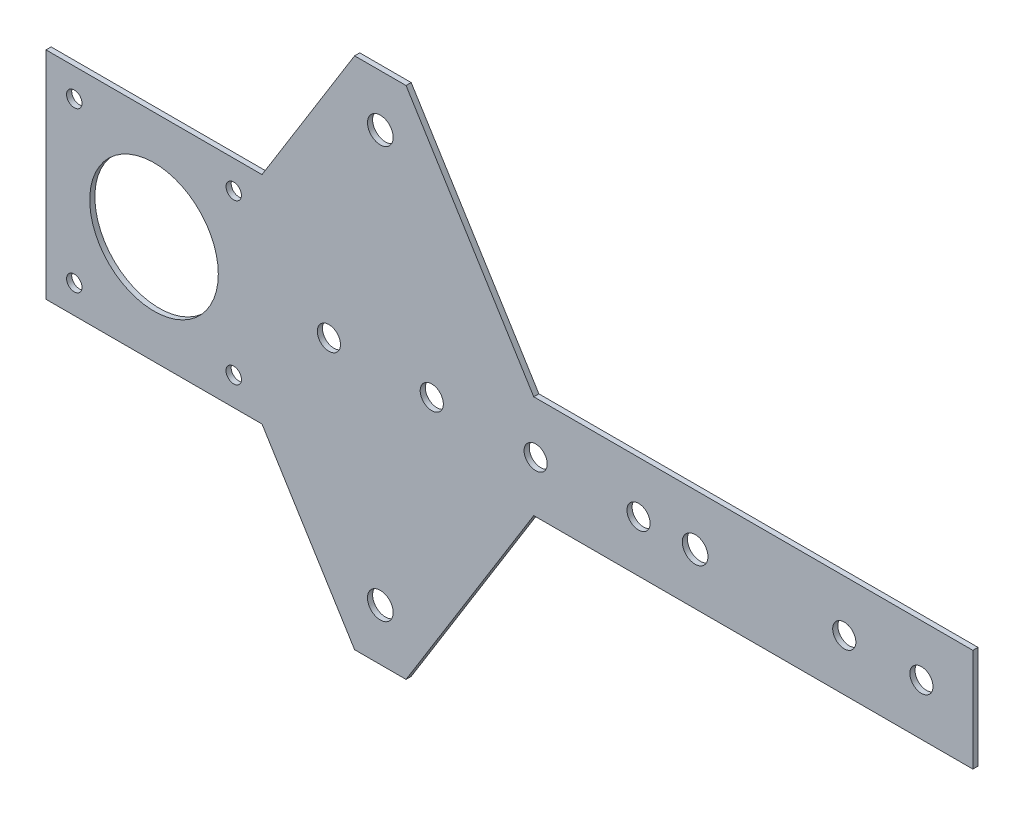
from build123d import *

# Parameters (mm, degrees)
SKETCH1_R          = 12.5
SKETCH1_R_2        = 1.5
SKETCH1_R_3        = 2.5
SKETCH1_R_4        = 2.25
BASE_FLANGE1_DEPTH = 1


# Sheet-metal steps are written as plain solids
with BuildPart() as part:
    # Sketch1 → Base-Flange1 (new body)
    with BuildSketch(Plane.XY):
        Polygon((-90.1, -21), (-48.1, -21), (-30.1, -50), (-20.1, -50), (4.727586207, -10), (90.1, -10), (90.1, 10), (4.727586207, 10), (-20.1, 50), (-30.1, 50), (-48.1, 21), (-90.1, 21), align=None)
        with Locations((-69.1, 0)):
            Circle(SKETCH1_R, mode=Mode.SUBTRACT)
        with Locations((-84.6, 15.5)):
            Circle(SKETCH1_R_2, mode=Mode.SUBTRACT)
        with Locations((-25.1, -40)):
            Circle(SKETCH1_R_3, mode=Mode.SUBTRACT)
        with Locations((80.1, 0)):
            Circle(SKETCH1_R_4, mode=Mode.SUBTRACT)
        with Locations((65.1, 0)):
            Circle(SKETCH1_R_4, mode=Mode.SUBTRACT)
        with Locations((25.1, 0)):
            Circle(SKETCH1_R_4, mode=Mode.SUBTRACT)
        with Locations((5.1, 0)):
            Circle(SKETCH1_R_4, mode=Mode.SUBTRACT)
        with Locations((36.1, 0)):
            Circle(SKETCH1_R_3, mode=Mode.SUBTRACT)
        with Locations(Location((-25.1, 40, 0), (0, 0, 180))):
            Circle(SKETCH1_R_3, mode=Mode.SUBTRACT)
        with Locations((-15.1, 0)):
            Circle(SKETCH1_R_4, mode=Mode.SUBTRACT)
        with Locations((-35.1, 0)):
            Circle(SKETCH1_R_4, mode=Mode.SUBTRACT)
        with Locations((-53.6, 15.5)):
            Circle(SKETCH1_R_2, mode=Mode.SUBTRACT)
        with Locations((-53.6, -15.5)):
            Circle(SKETCH1_R_2, mode=Mode.SUBTRACT)
        with Locations((-84.6, -15.5)):
            Circle(SKETCH1_R_2, mode=Mode.SUBTRACT)
    extrude(amount=-BASE_FLANGE1_DEPTH)


solid = part.part
